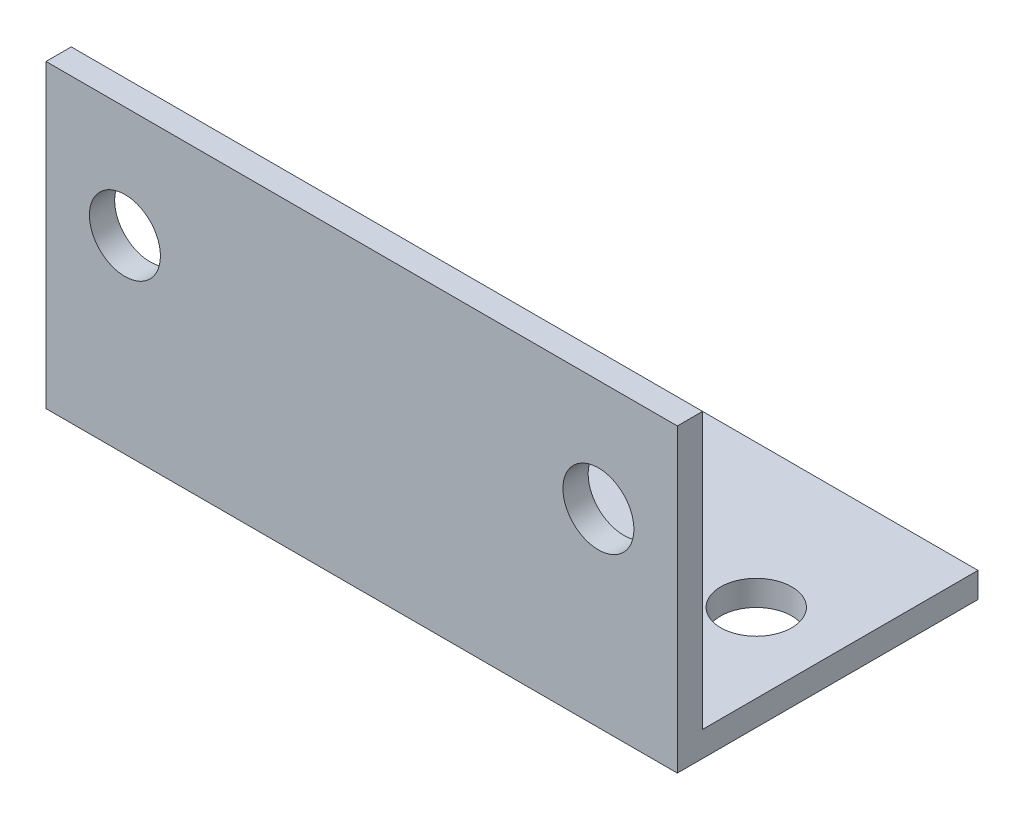
from build123d import *

# Parameters (mm, degrees)
BOSS_EXTRUDE1_DEPTH  = 20
M4_CLEARANCE_HOLE1_D = 4.5
M4_CLEARANCE_HOLE2_D = 4.5


with BuildPart() as part:
    # Sketch1 → Boss-Extrude1 (new, symmetric)
    with BuildSketch(Plane(origin=(0, 0, 0), x_dir=(0, 0, -1), z_dir=(1, 0, 0))):
        Polygon((0, 0), (0, 19.05), (1.6, 19.05), (1.6, 1.6), (19.05, 1.6), (19.05, 0), align=None)
    extrude(amount=BOSS_EXTRUDE1_DEPTH, both=True)

    # M4 Clearance Hole1 (through all)
    with Locations(Plane.XY):
        with Locations((-15, 12), (15, 12)):
            Hole(M4_CLEARANCE_HOLE1_D / 2)

    # M4 Clearance Hole2 (through all)
    with Locations(Plane(origin=(0, 0, 0), x_dir=(-1, 0, 0), z_dir=(0, -1, 0))):
        with Locations((-15, 10), (15, 10)):
            Hole(M4_CLEARANCE_HOLE2_D / 2)


solid = part.part
